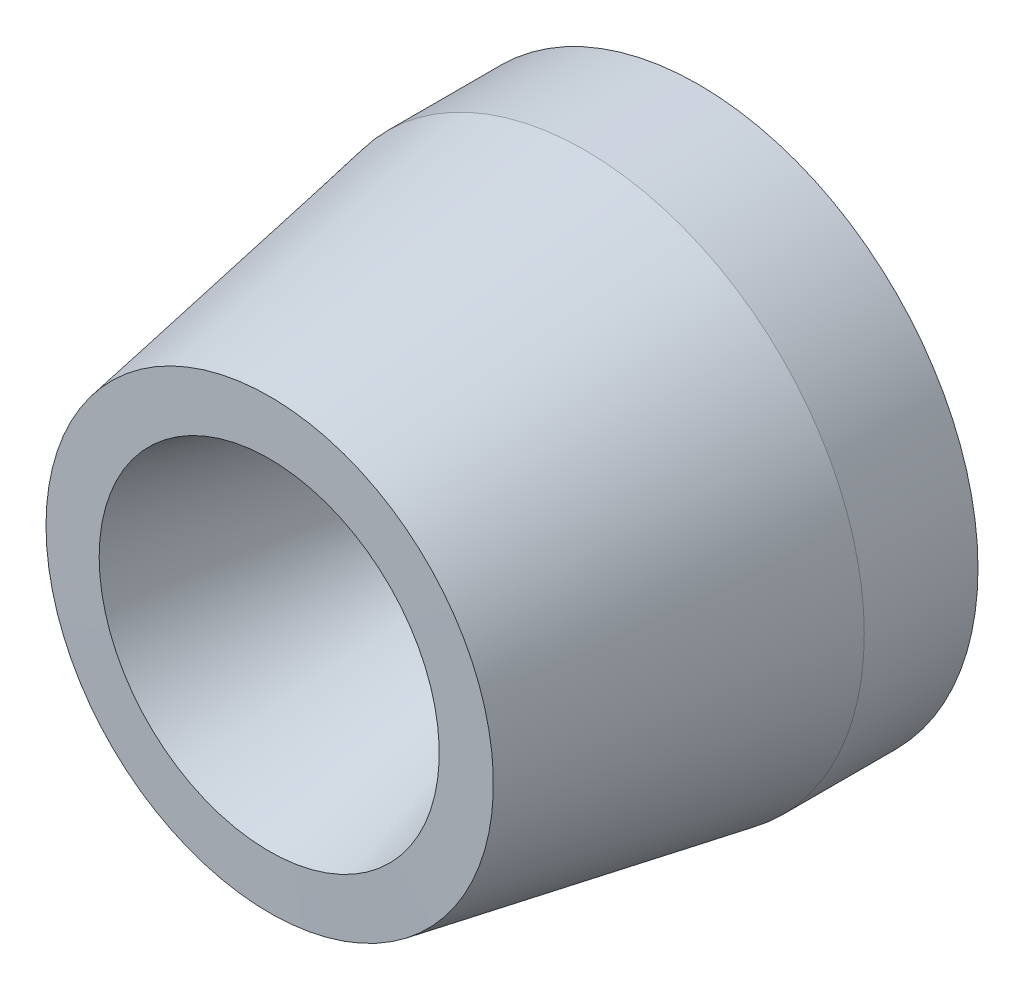
from build123d import *

# Parameters (mm, degrees)
FILLET1_R = 3.81


with BuildPart() as part:
    # Sketch1 → Revolve1 (revolve)
    with BuildSketch(Plane(origin=(0, 0, 0), x_dir=(1, 0, 0), z_dir=(0, 1, 0))):
        Polygon((40.280769277, 69.938213274), (30.621051615, 69.85), (17.145, 120.143309313), (17.145, 127.763309313), (50.292, 147.194032623), (50.292, 126.714724068), align=None)
    revolve(axis=Axis((0, 0, -91.44), (0, 0, 1)))

    # Fillet1
    fillet1_edges = [part.edges().sort_by_distance(p)[0] for p in [
        (-17.145, 0, -127.763309313),
        (-17.145, 0, -120.143309313),
    ]]
    fillet(fillet1_edges, radius=FILLET1_R)


solid = part.part
